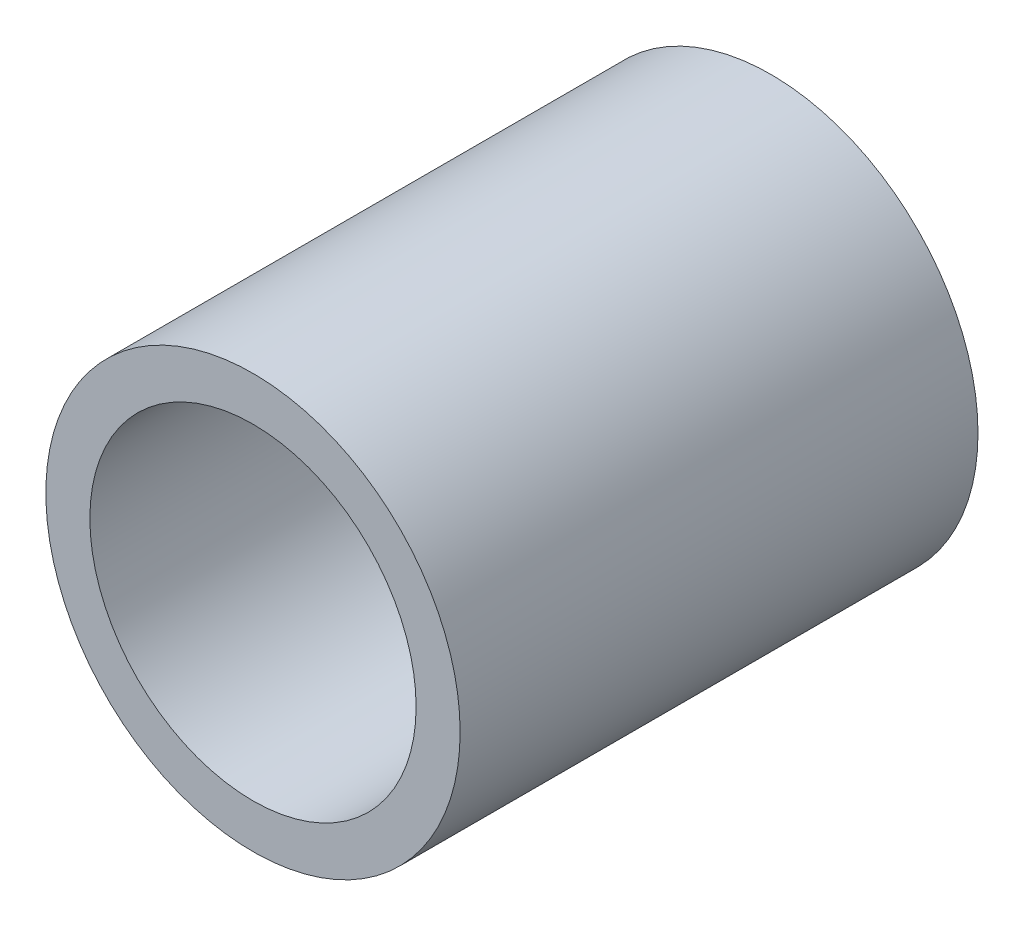
from build123d import *

# Parameters (mm, degrees)
SKETCH1_R           = 20.32
SKETCH1_R_2         = 16.002
BOSS_EXTRUDE1_DEPTH = 25.4


with BuildPart() as part:
    # Sketch1 → Boss-Extrude1 (new, symmetric)
    with BuildSketch(Plane.XY):
        Circle(SKETCH1_R)
        Circle(SKETCH1_R_2, mode=Mode.SUBTRACT)
    extrude(amount=BOSS_EXTRUDE1_DEPTH, both=True)


solid = part.part
